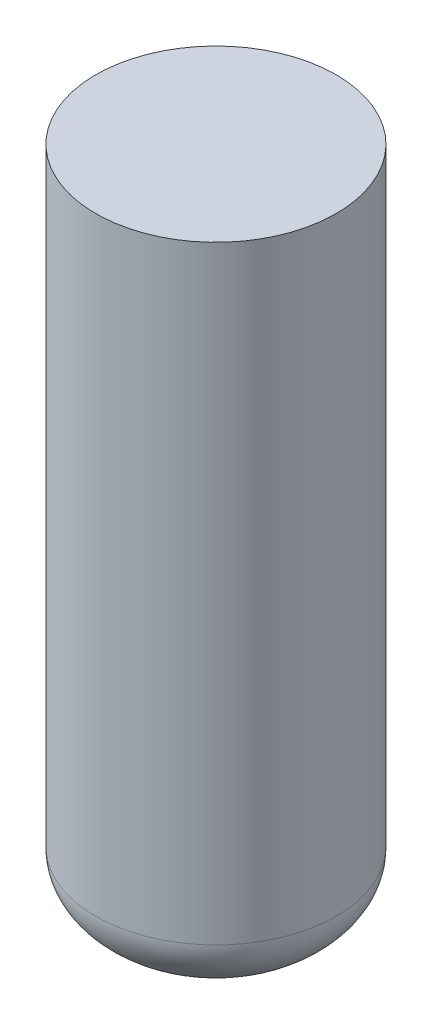
from build123d import *

# Parameters (mm, degrees)
SKETCH1_R                = 95.25
BOSS_EXTRUDE1_DEPTH      = 482.6
F_7_START                = -62.484
SKETCH4_R                = 95.25
F_7_PERCENT_ULLAGE_DEPTH = 62.484


with BuildPart() as part:
    # Sketch1 → Boss-Extrude1 (new body)
    with BuildSketch(Plane(origin=(0, 0, 0), x_dir=(1, 0, 0), z_dir=(0, 1, 0))):
        Circle(SKETCH1_R)
    extrude(amount=BOSS_EXTRUDE1_DEPTH)

    # Sketch2 → Revolve1 (revolve)
    with BuildSketch(Plane(origin=(0, 0, 0), x_dir=(0, 0, -1), z_dir=(1, 0, 0))):
        with BuildLine():
            Line((0, 544.576), (0, 482.6))
            Line((0, 482.6), (95.25, 482.6))
            add(Edge.make_bspline(
                [(95.25, 482.6), (95.25, 544.576), (0, 544.576)],
                knots=[0, 0, 0, 1.570796327, 1.570796327, 1.570796327], degree=2, weights=[1, 0.707106781, 1]))
        make_face()
    revolve(axis=Axis((0, 544.576, 0), (0, -1, 0)))

    # Sketch3 → Revolve2 (revolve)
    with BuildSketch(Plane(origin=(0, 0, 0), x_dir=(0, 0, -1), z_dir=(1, 0, 0))):
        with BuildLine():
            Line((0, -59.69), (0, 0))
            Line((0, 0), (95.25, 0))
            add(Edge.make_bspline(
                [(0, -59.69), (95.25, -59.69), (95.25, 0)],
                knots=[4.71238898, 4.71238898, 4.71238898, 6.283185307, 6.283185307, 6.283185307], degree=2, weights=[1, 0.707106781, 1]))
        make_face()
    revolve(axis=Axis((0, -59.69, 0), (0, 1, 0)))

    # Sketch4 → 7 Percent Ullage (cut)
    with BuildSketch(Plane(origin=(0, 544.576, 0), x_dir=(1, 0, 0), z_dir=(0, 1, 0)).offset(F_7_START)):
        Circle(SKETCH4_R)
    extrude(amount=F_7_PERCENT_ULLAGE_DEPTH, mode=Mode.SUBTRACT)


solid = part.part
